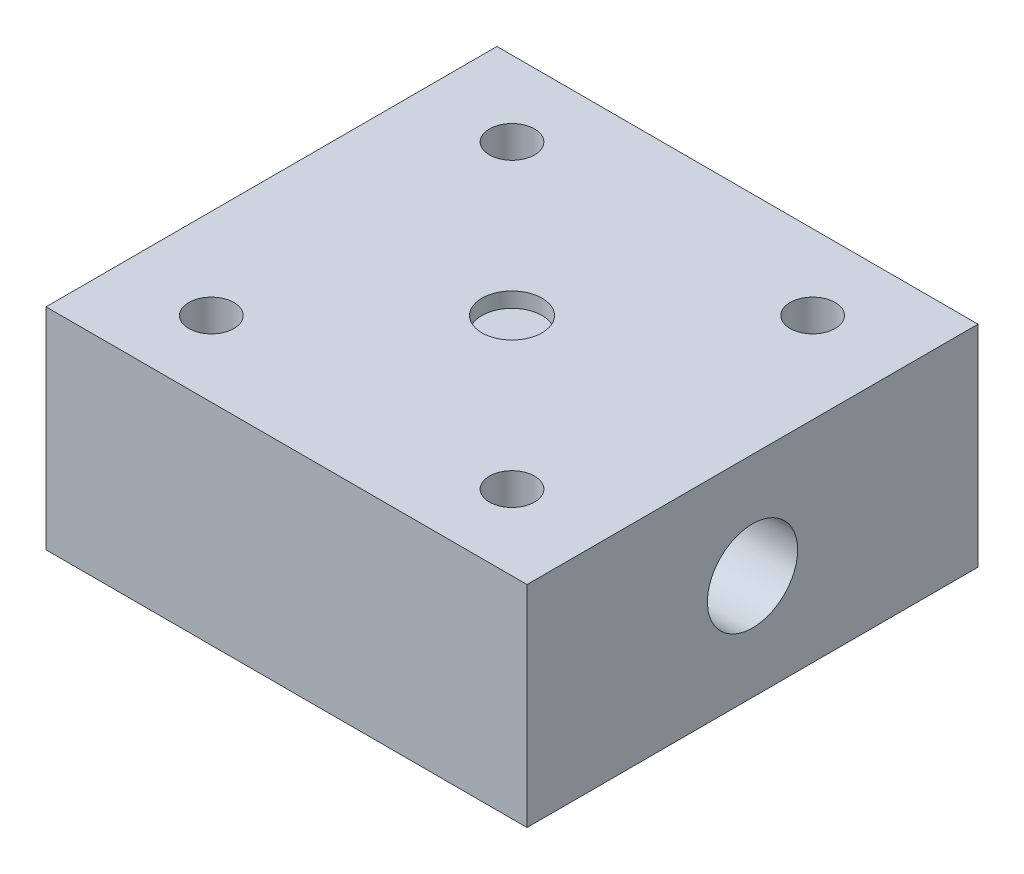
from build123d import *

# Parameters (mm, degrees)
SKETCH_1_W          = 32
SKETCH_1_H          = 14
EXTRUDE_1_DEPTH     = 30
SKETCH_2_R          = 1.5
CUT_EXTRUDE_1_DEPTH = 10
CUT_EXTRUDE_2_REACH = 46.418
SKETCH_3_R          = 3
SKETCH1_R           = 2
CUT_EXTRUDE1_DEPTH  = 1


with BuildPart() as part:
    # 草图1 → 凸台-拉伸1 (new body)
    with BuildSketch(Plane.XY):
        Rectangle(SKETCH_1_W, SKETCH_1_H)
    extrude(amount=-EXTRUDE_1_DEPTH)

    # 草图2 → 切除-拉伸1 (cut)
    with BuildSketch(Plane(origin=(0, 7, 0), x_dir=(1, 0, 0), z_dir=(0, 1, 0))):
        with Locations((-10, 25)):
            Circle(SKETCH_2_R)
        with Locations((10, 25)):
            Circle(SKETCH_2_R)
        with Locations((10, 5)):
            Circle(SKETCH_2_R)
        with Locations((-10, 5)):
            Circle(SKETCH_2_R)
    extrude(amount=-CUT_EXTRUDE_1_DEPTH, mode=Mode.SUBTRACT)

    # 草图3 → 切除-拉伸2 (cut, up to next)
    with BuildSketch(Plane(origin=(16, 0, 0), x_dir=(0, 0, -1), z_dir=(1, 0, 0)), mode=Mode.PRIVATE) as cut_extrude_2_sk1:
        with Locations((15, 0)):
            Circle(SKETCH_3_R)
    cut_extrude_2_tool1 = extrude(cut_extrude_2_sk1.sketch, amount=-CUT_EXTRUDE_2_REACH, mode=Mode.PRIVATE) & part.part
    add(cut_extrude_2_tool1.solids().sort_by_distance((16, 0, -15))[0], mode=Mode.SUBTRACT)

    # Sketch1 → Cut-Extrude1 (cut)
    with BuildSketch(Plane(origin=(0, 7, 0), x_dir=(1, 0, 0), z_dir=(0, 1, 0))):
        with Locations((0, 15)):
            Circle(SKETCH1_R)
    extrude(amount=-CUT_EXTRUDE1_DEPTH, mode=Mode.SUBTRACT)


solid = part.part
